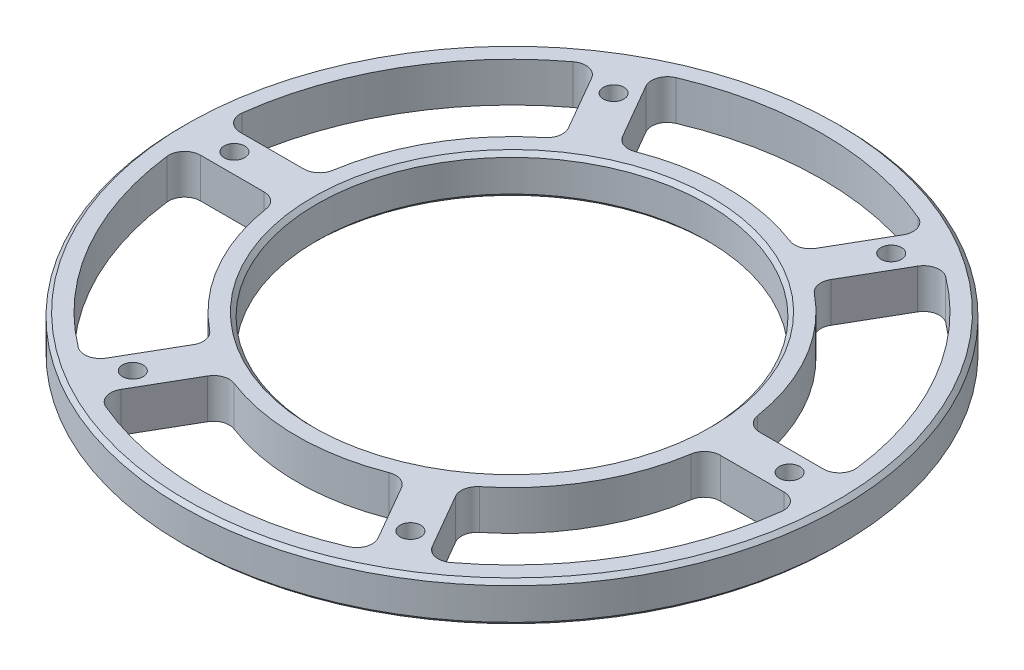
from build123d import *

# Parameters (mm, degrees)
F_6_0_204_DIAMETER_HOLE1_D = 5.1816
CIRPATTERN3_COUNT          = 6
CUT_EXTRUDE1_DEPTH         = 118.9457082051577
FILLET1_R                  = 4
CIRPATTERN4_COUNT          = 6
FILLET1_OF_CIRPATTERN4_R   = 4
CHAMFER1_SIZE              = 1
CHAMFER2_SIZE              = 1


with BuildPart() as part:
    # Sketch2 → Revolve1 (revolve)
    with BuildSketch(Plane(origin=(0, 0, 0), x_dir=(0, 0, -1), z_dir=(1, 0, 0))):
        Polygon((-49.2125, -4.7e-16), (-83.09991000000001, -4.15e-15), (-83.09991000000001, 9.999999999999996), (-49.2125, 9.999999999999995), align=None)
    revolve(axis=Axis((0, -0.500000000000003, 0), (0, 1, 0)))

    # #6 (0.204) Diameter Hole1 (through all)
    with Locations(Plane(origin=(0, 9.999999999999995, 0), x_dir=(1, 0, 0), z_dir=(0, 1, 0))):
        with Locations((-35, 60.621778265)):
            f_6_0_204_diameter_hole1 = Hole(F_6_0_204_DIAMETER_HOLE1_D / 2)

    # CirPattern3: #6 (0.204) Diameter Hole1 ×6 about axis
    cirpattern3_axis = Axis((0, -0.500000000000003, 0), (0, 1, 0))
    for i in range(1, CIRPATTERN3_COUNT):
        add(f_6_0_204_diameter_hole1.rotate(cirpattern3_axis, i * 360 / CIRPATTERN3_COUNT), mode=Mode.SUBTRACT)

    # Sketch8 → Cut-Extrude1 (cut, through all)
    with BuildSketch(Plane(origin=(0, 9.999999999999995, 0), x_dir=(1, 0, 0), z_dir=(0, 1, 0))):
        with BuildLine():
            Line((-22.660589701137386, 49.24929269184184), (-34.639720113213606, 69.99775519605132))
            ThreePointArc((-34.639720113213606, 69.99775519605132), (4.78e-15, 78.09991000000002), (34.639720113213606, 69.99775519605132))
            Line((34.639720113213606, 69.99775519605132), (22.660589701137386, 49.24929269184184))
            ThreePointArc((22.660589701137386, 49.24929269184184), (3.32e-15, 54.2125), (-22.660589701137386, 49.24929269184184))
        make_face()
    cut_extrude1 = extrude(amount=-CUT_EXTRUDE1_DEPTH, mode=Mode.SUBTRACT)

    # Fillet1
    fillet1_edges = [part.edges().sort_by_distance(p)[0] for p in [
        (-22.660589701137383, 4.999999999999997, -49.24929269184184),
        (22.66058970113739, 4.999999999999997, -49.249292691841845),
        (34.63972011321361, 4.999999999999997, -69.99775519605132),
        (-34.63972011321361, 4.999999999999997, -69.99775519605132),
    ]]
    fillet(fillet1_edges, radius=FILLET1_R)

    # CirPattern4: Cut-Extrude1 ×6 about axis
    cirpattern4_axis = Axis((0, -0.500000000000003, 0), (0, 1, 0))
    for i in range(1, CIRPATTERN4_COUNT):
        add(cut_extrude1.rotate(cirpattern4_axis, i * 360 / CIRPATTERN4_COUNT), mode=Mode.SUBTRACT)

    # Fillet1 of CirPattern4
    fillet1_of_cirpattern4_edges = [part.edges().sort_by_distance(p)[0] for p in [
        (-53.98143344011902, 4.999999999999997, -4.9999999999999325),
        (-31.320843738981637, 4.999999999999997, -44.24929269184193),
        (-43.29997415105781, 4.999999999999997, -64.99775519605143),
        (-77.93969426427144, 4.999999999999997, -4.999999999999908),
        (-31.32084373898165, 4.999999999999997, 44.2492926918419),
        (-53.981433440119034, 4.999999999999997, 4.999999999999911),
        (-77.93969426427142, 4.999999999999997, 4.999999999999883),
        (-43.29997415105783, 4.999999999999997, 64.9977551960514),
        (22.660589701137376, 4.999999999999997, 49.24929269184184),
        (-22.660589701137397, 4.999999999999997, 49.249292691841845),
        (-34.63972011321362, 4.999999999999997, 69.99775519605132),
        (34.639720113213606, 4.999999999999997, 69.99775519605132),
        (53.98143344011902, 4.999999999999997, 4.999999999999954),
        (31.320843738981615, 4.999999999999997, 44.24929269184194),
        (43.29997415105779, 4.999999999999997, 64.99775519605143),
        (77.93969426427142, 4.999999999999997, 4.999999999999936),
        (31.320843738981637, 4.999999999999997, -44.249292691841916),
        (53.981433440119034, 4.999999999999997, -4.9999999999999325),
        (77.93969426427144, 4.999999999999997, -4.999999999999908),
        (43.29997415105781, 4.999999999999997, -64.99775519605143),
    ]]
    fillet(fillet1_of_cirpattern4_edges, radius=FILLET1_OF_CIRPATTERN4_R)

    # Chamfer1
    chamfer1_edges = [part.edges().sort_by_distance(p)[0] for p in [
        (6.03e-15, 9.999999999999995, -49.2125),
        (6.03e-15, -4.4e-16, -49.2125),
    ]]
    chamfer(chamfer1_edges, length=CHAMFER1_SIZE)

    # Chamfer2
    chamfer2_edges = [part.edges().sort_by_distance(p)[0] for p in [
        (1.018e-14, 9.999999999999996, -83.09991000000001),
        (1.018e-14, -4.16e-15, -83.09991000000001),
    ]]
    chamfer(chamfer2_edges, length=CHAMFER2_SIZE)


solid = part.part
